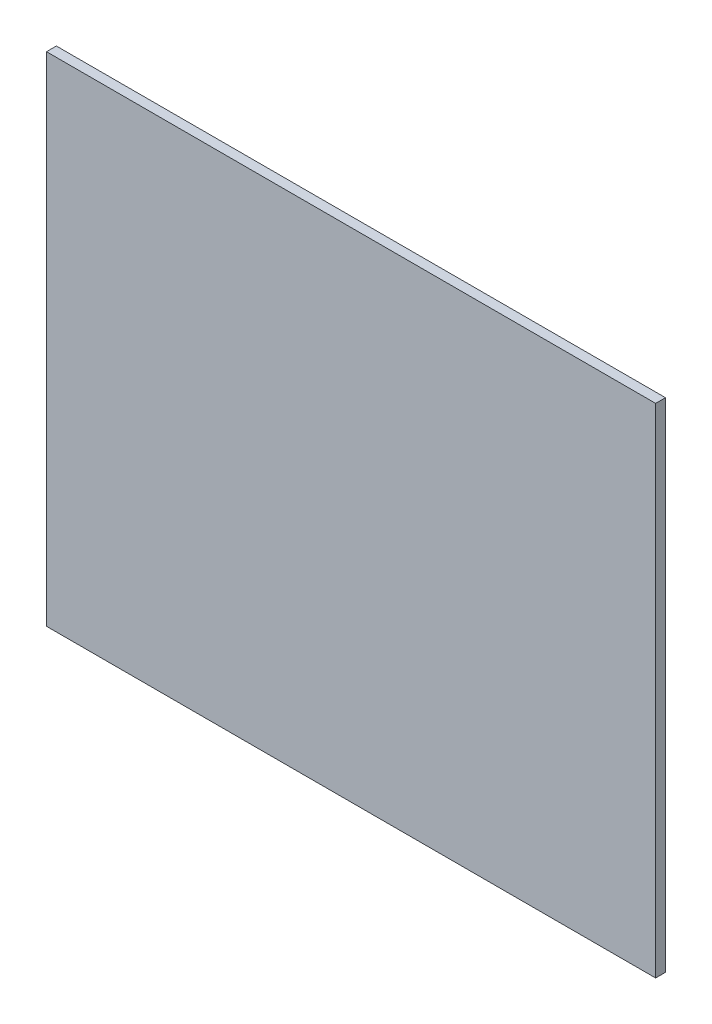
from build123d import *

# Parameters (mm, degrees)
SKETCH1_W           = 98.840202878
SKETCH1_H           = 80.747426435
BOSS_EXTRUDE1_DEPTH = 1.6


with BuildPart() as part:
    # Sketch1 → Boss-Extrude1 (new body)
    with BuildSketch(Plane.XY):
        with Locations((49.420101439, 40.373713218)):
            Rectangle(SKETCH1_W, SKETCH1_H)
    extrude(amount=BOSS_EXTRUDE1_DEPTH)


solid = part.part
